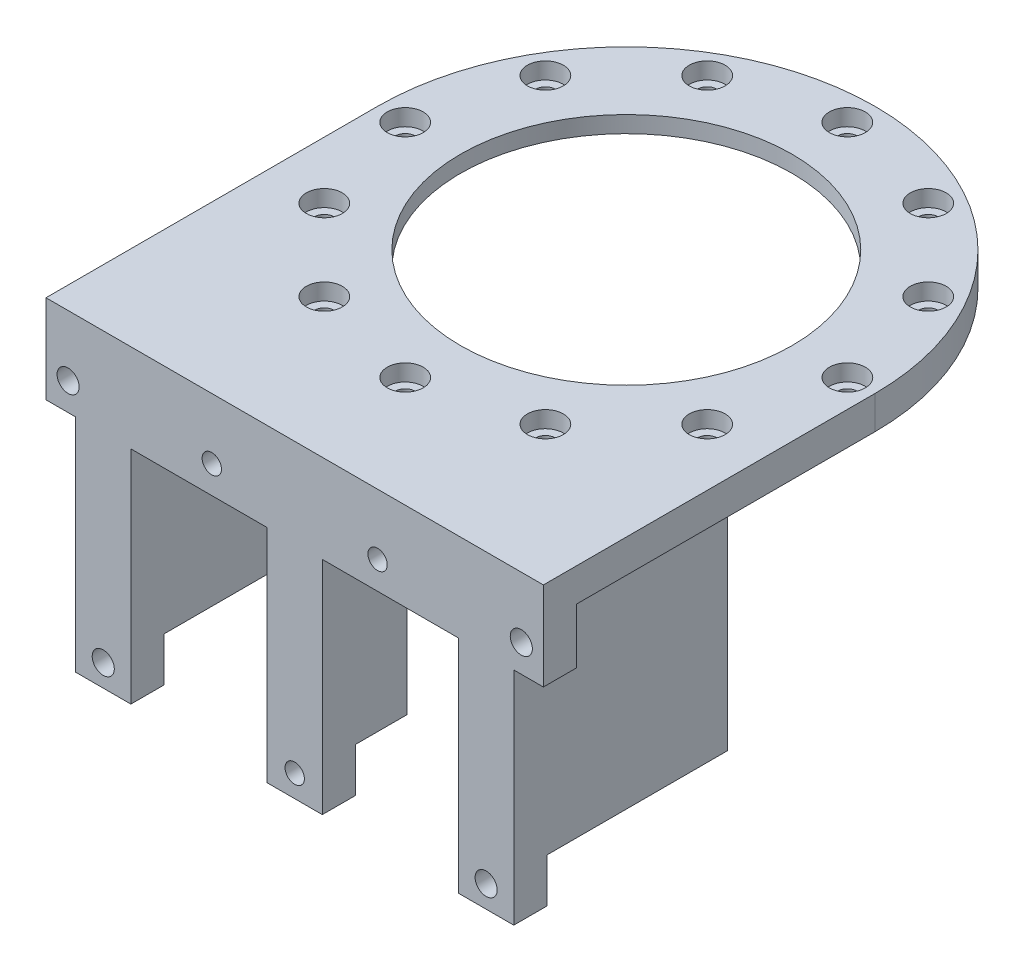
from build123d import *

# Parameters (mm, degrees)
SKETCH1_R           = 45
SKETCH1_R_2         = 30
SKETCH1_R_3         = 1.75
BOSS_EXTRUDE1_DEPTH = 6
SKETCH2_R           = 36
CUT_EXTRUDE1_DEPTH  = 3
SKETCH3_R           = 3.25
CUT_EXTRUDE2_DEPTH  = 3
BOSS_EXTRUDE4_DEPTH = 6
SKETCH5_W           = 90
SKETCH5_H           = 6
BOSS_EXTRUDE6_DEPTH = 10
BOSS_EXTRUDE7_START = 50
BOSS_EXTRUDE7_DEPTH = 50
SKETCH7_W           = 32.702351339
SKETCH7_H           = 8
CUT_EXTRUDE3_DEPTH  = 116.169881545
SKETCH8_R           = 2
SKETCH8_R_2         = 1.75
CUT_EXTRUDE5_DEPTH  = 120.691269523


with BuildPart() as part:
    # Sketch1 → Boss-Extrude1 (new body)
    with BuildSketch(Plane(origin=(0, 0, 0), x_dir=(1, 0, 0), z_dir=(0, 1, 0))):
        Circle(SKETCH1_R)
        Circle(SKETCH1_R_2, mode=Mode.SUBTRACT)
        with Locations((0, 40)):
            Circle(SKETCH1_R_3, mode=Mode.SUBTRACT)
        with Locations((20, 34.641016151)):
            Circle(SKETCH1_R_3, mode=Mode.SUBTRACT)
        with Locations((34.641016151, 20)):
            Circle(SKETCH1_R_3, mode=Mode.SUBTRACT)
        with Locations((40, 0)):
            Circle(SKETCH1_R_3, mode=Mode.SUBTRACT)
        with Locations((34.641016151, -20)):
            Circle(SKETCH1_R_3, mode=Mode.SUBTRACT)
        with Locations((20, -34.641016151)):
            Circle(SKETCH1_R_3, mode=Mode.SUBTRACT)
        with Locations((0, -40)):
            Circle(SKETCH1_R_3, mode=Mode.SUBTRACT)
        with Locations((-20, -34.641016151)):
            Circle(SKETCH1_R_3, mode=Mode.SUBTRACT)
        with Locations((-34.641016151, -20)):
            Circle(SKETCH1_R_3, mode=Mode.SUBTRACT)
        with Locations((-40, 0)):
            Circle(SKETCH1_R_3, mode=Mode.SUBTRACT)
        with Locations((-34.641016151, 20)):
            Circle(SKETCH1_R_3, mode=Mode.SUBTRACT)
        with Locations((-20, 34.641016151)):
            Circle(SKETCH1_R_3, mode=Mode.SUBTRACT)
    extrude(amount=BOSS_EXTRUDE1_DEPTH)

    # Sketch2 → Cut-Extrude1 (cut)
    with BuildSketch(Plane.XZ):
        Circle(SKETCH2_R)
    extrude(amount=-CUT_EXTRUDE1_DEPTH, mode=Mode.SUBTRACT)

    # Sketch3 → Cut-Extrude2 (cut)
    with BuildSketch(Plane(origin=(0, 6, 0), x_dir=(1, 0, 0), z_dir=(0, 1, 0))):
        with Locations((40, 0)):
            Circle(SKETCH3_R)
        with Locations((34.641016151, -20)):
            Circle(SKETCH3_R)
        with Locations((20, -34.641016151)):
            Circle(SKETCH3_R)
        with Locations((0, -40)):
            Circle(SKETCH3_R)
        with Locations((-20, -34.641016151)):
            Circle(SKETCH3_R)
        with Locations((-34.641016151, -20)):
            Circle(SKETCH3_R)
        with Locations((-40, 0)):
            Circle(SKETCH3_R)
        with Locations((-34.641016151, 20)):
            Circle(SKETCH3_R)
        with Locations((-20, 34.641016151)):
            Circle(SKETCH3_R)
        with Locations((0, 40)):
            Circle(SKETCH3_R)
        with Locations((20, 34.641016151)):
            Circle(SKETCH3_R)
        with Locations((34.641016151, 20)):
            Circle(SKETCH3_R)
    extrude(amount=-CUT_EXTRUDE2_DEPTH, mode=Mode.SUBTRACT)

    # Sketch4 → Boss-Extrude4 (add)
    with BuildSketch(Plane.XZ):
        with BuildLine():
            Line((45, 0), (45, 60))
            Line((45, 60), (-45, 60))
            Line((-45, 60), (-45, 0))
            ThreePointArc((-45, 0), (0, 45), (45, 0))
        make_face()
    extrude(amount=-BOSS_EXTRUDE4_DEPTH)

    # Sketch5 → Boss-Extrude6 (add)
    with BuildSketch(Plane.XZ):
        with Locations((0, 57)):
            Rectangle(SKETCH5_W, SKETCH5_H)
    extrude(amount=BOSS_EXTRUDE6_DEPTH)

    # Sketch6 → Boss-Extrude7 (add)
    with BuildSketch(Plane.XZ.offset(BOSS_EXTRUDE7_START)):
        with BuildLine():
            Line((39.641016151, 21.297648661), (39.641016151, 60))
            Line((39.641016151, 60), (29.641016151, 60))
            Line((29.641016151, 60), (29.641016151, 33.858679264))
            ThreePointArc((29.641016151, 33.858679264), (35.205750559, 28.027756377), (39.641016151, 21.297648661))
        make_face()
        with BuildLine():
            Line((-5, 60), (5, 60))
            Line((5, 60), (5, 44.72135955))
            ThreePointArc((5, 44.72135955), (0, 45), (-5, 44.72135955))
            Line((-5, 44.72135955), (-5, 60))
        make_face()
        with BuildLine():
            Line((-29.641016151, 60), (-29.641016151, 33.858679264))
            ThreePointArc((-29.641016151, 33.858679264), (-35.205750559, 28.027756377), (-39.641016151, 21.297648661))
            Line((-39.641016151, 21.297648661), (-39.641016151, 60))
            Line((-39.641016151, 60), (-29.641016151, 60))
        make_face()
    extrude(amount=-BOSS_EXTRUDE7_DEPTH)

    # Sketch7 → Cut-Extrude3 (cut, through all)
    with BuildSketch(Plane(origin=(39.641016151, 0, 0), x_dir=(0, 0, -1), z_dir=(1, 0, 0))):
        with Locations((-37.64882433, -46)):
            Rectangle(SKETCH7_W, SKETCH7_H)
    extrude(amount=-CUT_EXTRUDE3_DEPTH, mode=Mode.SUBTRACT)

    # Sketch8 → Cut-Extrude5 (cut, through all)
    with BuildSketch(Plane(origin=(0, 0, 54), x_dir=(-1, 0, 0), z_dir=(0, 0, -1))):
        with Locations((41, -5)):
            Circle(SKETCH8_R)
        with Locations((34.641016151, -46)):
            Circle(SKETCH8_R)
        with Locations((0, -46)):
            Circle(SKETCH8_R_2)
        with Locations((15, -5)):
            Circle(SKETCH8_R_2)
        with Locations((-34.641016151, -46)):
            Circle(SKETCH8_R)
        with Locations((-41, -5)):
            Circle(SKETCH8_R)
        with Locations((-15, -5)):
            Circle(SKETCH8_R_2)
    extrude(amount=-CUT_EXTRUDE5_DEPTH, mode=Mode.SUBTRACT)


solid = part.part
